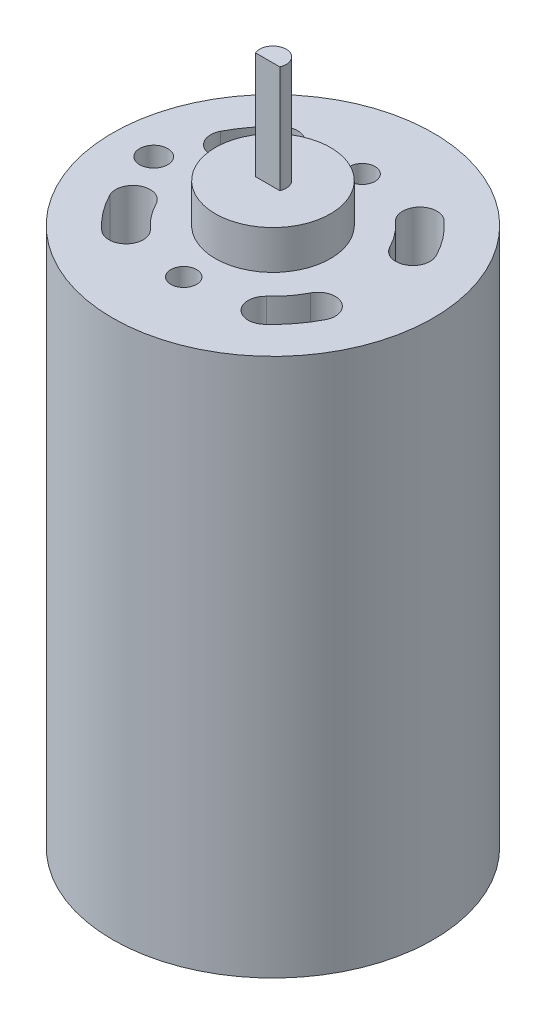
from build123d import *

# Parameters (mm, degrees)
SKETCH1_R           = 13.843
BOSS_EXTRUDE1_DEPTH = 46.482
SKETCH2_R           = 4.9657
BOSS_EXTRUDE2_DEPTH = 3.3528
SKETCH3_R           = 4.953
BOSS_EXTRUDE3_DEPTH = 2.8956
BOSS_EXTRUDE4_DEPTH = 9.2583
SKETCH5_R           = 1.11125
SKETCH5_R_2         = 1.21285
CUT_EXTRUDE1_DEPTH  = 5.4356
MIRROR1_START       = 41.0464
MIRROR1_DEPTH       = 5.4356


# Read off the part's stored shape, not the designer's step: Mirror1
with BuildPart() as part:
    # Sketch1 → Boss-Extrude1 (new body)
    with BuildSketch(Plane(origin=(0, 0, 0), x_dir=(1, 0, 0), z_dir=(0, 1, 0))):
        with Locations(Location((0, 0, 0), (0, 0, 270))):
            Circle(SKETCH1_R)
    extrude(amount=BOSS_EXTRUDE1_DEPTH)

    # Sketch2 → Boss-Extrude2 (add)
    with BuildSketch(Plane(origin=(0, 46.482, 0), x_dir=(1, 0, 0), z_dir=(0, 1, 0))):
        with Locations(Location((0, 0, 0), (0, 0, 270))):
            Circle(SKETCH2_R)
    extrude(amount=BOSS_EXTRUDE2_DEPTH)

    # Sketch3 → Boss-Extrude3 (add)
    with BuildSketch(Plane.XZ):
        with Locations(Location((0, 0, 0), (0, 0, 270))):
            Circle(SKETCH3_R)
    extrude(amount=BOSS_EXTRUDE3_DEPTH)

    # Sketch4 → Boss-Extrude4 (add)
    with BuildSketch(Plane(origin=(0, 49.8348, 0), x_dir=(1, 0, 0), z_dir=(0, 1, 0))):
        with BuildLine():
            Line((-1.047576804, -0.4572), (1.047576804, -0.4572))
            ThreePointArc((1.047576804, -0.4572), (0, 1.143), (-1.047576804, -0.4572))
        make_face()
    extrude(amount=BOSS_EXTRUDE4_DEPTH)

    # Sketch5 → Cut-Extrude1 (cut)
    with BuildSketch(Plane(origin=(0, 46.482, 0), x_dir=(1, 0, 0), z_dir=(0, 1, 0))):
        with Locations(Location((0, 7.70255, 0), (0, 0, 270))):
            Circle(SKETCH5_R)
        with Locations(Location((0, -7.70255, 0), (0, 0, 270))):
            Circle(SKETCH5_R)
        with Locations(Location((-10.29335, 0, 0), (0, 0, 270))):
            Circle(SKETCH5_R_2)
        with BuildLine():
            ThreePointArc((-5.018539731, 5.564108911), (-5.941000388, 4.566132214), (-6.668031862, 3.417952617))
            ThreePointArc((-6.668031862, 3.417952617), (-8.668133869, 2.773445377), (-9.312641109, 4.773547383))
            ThreePointArc((-9.312641109, 4.773547383), (-8.297261558, 6.377106685), (-7.008943624, 7.770891089))
            ThreePointArc((-7.008943624, 7.770891089), (-4.910350588, 7.662701947), (-5.018539731, 5.564108911))
        make_face()
        with BuildLine():
            ThreePointArc((-6.668031862, -3.417952617), (-8.668133869, -2.773445377), (-9.312641109, -4.773547383))
            ThreePointArc((-9.312641109, -4.773547383), (-8.297261558, -6.377106685), (-7.008943624, -7.770891089))
            ThreePointArc((-7.008943624, -7.770891089), (-4.910350588, -7.662701947), (-5.018539731, -5.564108911))
            ThreePointArc((-5.018539731, -5.564108911), (-5.941000388, -4.566132214), (-6.668031862, -3.417952617))
        make_face()
    extrude(amount=-CUT_EXTRUDE1_DEPTH, mode=Mode.SUBTRACT)

    # Mirror1 outline → Mirror1 (cut)
    with BuildSketch(Plane(origin=(0, 0, 0), x_dir=(1, 0, 0), z_dir=(0, 1, 0)).offset(MIRROR1_START)):
        with BuildLine():
            ThreePointArc((7.008943624, -7.770891089), (8.297261558, -6.377106685), (9.312641109, -4.773547383))
            ThreePointArc((9.312641109, -4.773547383), (8.668133868, -2.773445377), (6.668031862, -3.417952617))
            ThreePointArc((6.668031862, -3.417952617), (5.941000388, -4.566132214), (5.018539731, -5.564108911))
            ThreePointArc((5.018539731, -5.564108911), (4.910350588, -7.662701947), (7.008943624, -7.770891089))
        make_face()
        with BuildLine():
            ThreePointArc((6.668031862, 3.417952617), (8.668133868, 2.773445377), (9.312641109, 4.773547383))
            ThreePointArc((9.312641109, 4.773547383), (8.297261558, 6.377106685), (7.008943624, 7.770891089))
            ThreePointArc((7.008943624, 7.770891089), (4.910350588, 7.662701947), (5.018539731, 5.564108911))
            ThreePointArc((5.018539731, 5.564108911), (5.941000388, 4.566132214), (6.668031862, 3.417952617))
        make_face()
    extrude(amount=MIRROR1_DEPTH, mode=Mode.SUBTRACT)


solid = part.part
